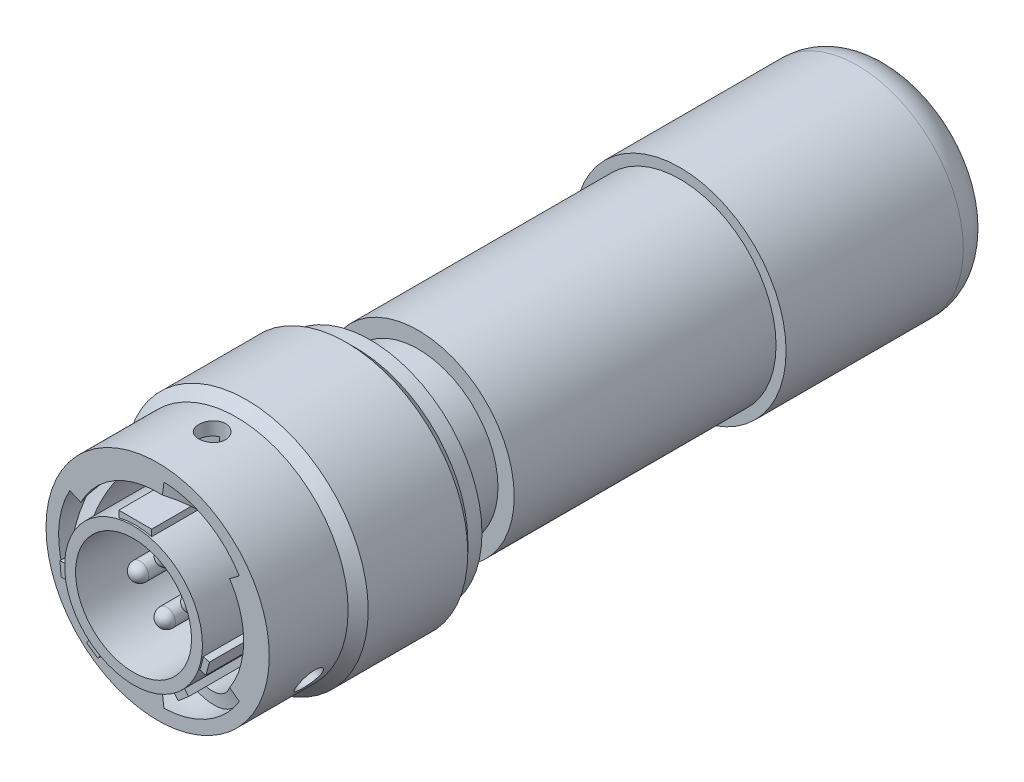
from build123d import *

# Parameters (mm, degrees)
SKETCH3_W               = 22.7718
SKETCH3_H               = 5.1435
BOSS_EXTRUDE1_START     = -9.2202
BOSS_EXTRUDE1_DEPTH     = 9.0678
SKETCH6_R               = 1.1938
CUT_EXTRUDE1_DEPTH      = 36.970404501
CUT_SWEEP1_PITCH        = 19.5072
CIRPATTERN1_COUNT       = 3
SKETCH10_XP_R           = 0.79375
BOSS_EXTRUDE10_XP_DEPTH = 5.7912
FILLET10_XP_R           = 0.79375


with BuildPart() as part:
    # Sketch3 → Revolve1 (revolve)
    with BuildSketch(Plane(origin=(0, 0, 0), x_dir=(0, 0, -1), z_dir=(1, 0, 0)), mode=Mode.PRIVATE) as revolve1_sk:
        Polygon((9.7282, 6.7437), (9.7282, 6.085416667), (19.8, 6.085416667), (20.858333333, 7.14375), (31.441666667, 7.14375), (32.5, 6.085416667), (32.5, 5.1943), (0, 5.1943), (0, 6.1722), (9.2202, 6.1722), (9.2202, 6.7437), align=None)
        with Locations((19.3361, 2.57175)):
            Rectangle(SKETCH3_W, SKETCH3_H)
    revolve(revolve1_sk.sketch.rotate(Axis((0, 0, 0), (0, 0, -1)), 90), axis=Axis((0, 0, 0), (0, 0, -1)))

    # Sketch4 → Boss-Extrude1 (add)
    with BuildSketch(Plane.XY.offset(BOSS_EXTRUDE1_START)):
        with BuildLine():
            Line((-1.4732, 6.580818448), (1.4732, 6.580818448))
            Line((1.4732, 6.580818448), (1.4732, 5.993808022))
            ThreePointArc((1.4732, 5.993808022), (0, 6.1722), (-1.4732, 5.993808022))
            Line((-1.4732, 5.993808022), (-1.4732, 6.580818448))
        make_face()
        with BuildLine():
            Line((6.645021782, -1.149423861), (6.329469602, -2.327080628))
            Line((6.329469602, -2.327080628), (5.774962091, -2.178500788))
            ThreePointArc((5.774962091, -2.178500788), (5.961887385, -1.59748291), (6.090514271, -1.000844021))
            Line((6.090514271, -1.000844021), (6.645021782, -1.149423861))
        make_face()
        with BuildLine():
            Line((4.784000735, -4.752980818), (3.85003935, -5.536667472))
            Line((3.85003935, -5.536667472), (3.481035284, -5.096905551))
            ThreePointArc((3.481035284, -5.096905551), (3.967413685, -4.728179512), (4.414996669, -4.313218897))
            Line((4.414996669, -4.313218897), (4.784000735, -4.752980818))
        make_face()
        with BuildLine():
            Line((-3.352836422, -5.85115182), (-4.351546594, -5.151847428))
            Line((-4.351546594, -5.151847428), (-4.022274477, -4.681598111))
            ThreePointArc((-4.022274477, -4.681598111), (-3.54022848, -5.055970248), (-3.023564305, -5.380902502))
            Line((-3.023564305, -5.380902502), (-3.352836422, -5.85115182))
        make_face()
        with BuildLine():
            Line((-6.637404047, -1.192626182), (-6.743664328, 0.021934394))
            Line((-6.743664328, 0.021934394), (-6.171780414, 0.071967753))
            ThreePointArc((-6.171780414, 0.071967753), (-6.148712916, -0.537942675), (-6.065520133, -1.142592823))
            Line((-6.065520133, -1.142592823), (-6.637404047, -1.192626182))
        make_face()
    extrude(amount=BOSS_EXTRUDE1_DEPTH)

    # Sketch10-xP → Boss-Extrude10-xP (add)
    with BuildSketch(Plane.XY.offset(-7.9502)):
        with Locations(Location((0, 2.3876, 0), (0, 0, 180))):
            Circle(SKETCH10_XP_R)
        with Locations(Location((2.3876, 0, 0), (0, 0, 180))):
            Circle(SKETCH10_XP_R)
        with Locations(Location((0, -2.3876, 0), (0, 0, 180))):
            Circle(SKETCH10_XP_R)
        with Locations(Location((-2.3876, 0, 0), (0, 0, 180))):
            Circle(SKETCH10_XP_R)
    extrude(amount=BOSS_EXTRUDE10_XP_DEPTH)

    # Fillet10-xP
    fillet10_xp_edges = [part.edges().sort_by_distance(p)[0] for p in [
        (3.18135, 0, -2.159),
        (0.79375, -2.3876, -2.159),
        (-1.59385, 0, -2.159),
        (0.79375, 2.3876, -2.159),
    ]]
    fillet(fillet10_xp_edges, radius=FILLET10_XP_R)


with BuildPart() as body_2:
    # Sketch5 → Revolve2 (revolve)
    with BuildSketch(Plane(origin=(0, 0, 0), x_dir=(0, 0, -1), z_dir=(1, 0, 0)), mode=Mode.PRIVATE) as revolve2_sk:
        Polygon((2.159, 10), (2.159, 7.7089), (17.399, 7.7089), (17.399, 8.9789), (21.209, 8.9789), (21.209, 10), (19.939, 10), (19.039, 10.9), (10.1202, 10.9), (9.2202, 10), align=None)
    revolve(revolve2_sk.sketch.rotate(Axis((0, 0, -32.5), (0, 0, 1)), 90), axis=Axis((0, 0, -32.5), (0, 0, 1)))

    # Sketch6 → Cut-Extrude1 (cut, through all)
    with BuildSketch(Plane(origin=(0, 0, 0), x_dir=(1, 0, 0), z_dir=(0, 1, 0))):
        with Locations(Location((0, 7.0358, 0), (0, 0, 90))):
            Circle(SKETCH6_R)
    cut_extrude1 = extrude(amount=CUT_EXTRUDE1_DEPTH, mode=Mode.SUBTRACT)

    # Cut-Sweep1: arcs per turn and ends read off the stored shape
    # Cut-Sweep1: the profile of Sketch8 screwed along a right-hand helix through 1.25 turns, 20 arcs to a turn; built about Z, then put on its axis
    cut_sweep1_z = Axis((0, 0, 0), (0, 0, 1))
    cut_sweep1_corners = [(7.590446941, 0.502912226, -20.755932851), (8.770179735, 0.502912226, -20.755932851), (8.770179735, -0.502912226, -18.258467149), (7.590446941, -0.502912226, -18.258467149)]
    with BuildLine(mode=Mode.PRIVATE) as cut_sweep1_profile:
        Line(cut_sweep1_corners[0], cut_sweep1_corners[1])
        Line(cut_sweep1_corners[2], cut_sweep1_corners[3])
        ThreePointArc((8.770179735, 0.502912226, -20.755932851), (8.87289733, 0, -19.5072), (8.770179735, -0.502912226, -18.258467149))
        ThreePointArc((7.590446941, -0.502912226, -18.258467149), (7.7089, 0, -19.5072), (7.590446941, 0.502912226, -20.755932851))
    cut_sweep1_cap = Face(cut_sweep1_profile.wire())
    cut_sweep1_arcs = [((8.770179735, 0.502912226, -20.755932851), (8.976817967, 0, -19.5072), (8.770179735, -0.502912226, -18.258467149), (1, 0.9884234437826221, 1)), ((7.590446941, -0.502912226, -18.258467149), (7.829201583, 0, -19.5072), (7.590446941, 0.502912226, -20.755932851), (1, 0.9846342463109203, 1))]  # start, shoulder, end, weights
    cut_sweep1_turn_angles = [0, 9, 18, 27, 36, 45, 54, 63, 72, 81, 90, 99, 108, 117, 126, 135, 144, 153, 162, 171, 180, 189, 198, 207, 216, 225, 234, 243, 252, 261, 270, 279, 288, 297, 306, 315, 324, 333, 342, 351, 360]
    cut_sweep1_turn_weights = [1, 0.9876883405951378, 1, 0.9876883405951378, 1, 0.9876883405951378, 1, 0.9876883405951378, 1, 0.9876883405951378, 1, 0.9876883405951378, 1, 0.9876883405951378, 1, 0.9876883405951378, 1, 0.9876883405951378, 1, 0.9876883405951378, 1, 0.9876883405951378, 1, 0.9876883405951378, 1, 0.9876883405951378, 1, 0.9876883405951378, 1, 0.9876883405951378, 1, 0.9876883405951378, 1, 0.9876883405951378, 1, 0.9876883405951378, 1, 0.9876883405951378, 1, 0.9876883405951378, 1]
    cut_sweep1_turn_rails = [Edge.make_bspline([Vector(p[0], p[1], 0).rotate(cut_sweep1_z, cut_sweep1_turn_angles[k]) / cut_sweep1_turn_weights[k] + Vector(0, 0, p[2] + CUT_SWEEP1_PITCH * cut_sweep1_turn_angles[k] / 360) for k in range(41)], [0, 0, 0, 1, 1, 2, 2, 3, 3, 4, 4, 5, 5, 6, 6, 7, 7, 8, 8, 9, 9, 10, 10, 11, 11, 12, 12, 13, 13, 14, 14, 15, 15, 16, 16, 17, 17, 18, 18, 19, 19, 20, 20, 20], 2, cut_sweep1_turn_weights) for p in cut_sweep1_corners]
    cut_sweep1_turn_sides = [*[Face.make_surface_from_curves(cut_sweep1_turn_rails[p[0]], cut_sweep1_turn_rails[p[1]]) for p in [(0, 1), (2, 3)]], *[Face.make_bezier_surface([[Vector(p[j][0], p[j][1], 0).rotate(cut_sweep1_z, cut_sweep1_turn_angles[2 * i + k]) / cut_sweep1_turn_weights[2 * i + k] + Vector(0, 0, p[j][2] + CUT_SWEEP1_PITCH * cut_sweep1_turn_angles[2 * i + k] / 360) for k in range(3)] for j in range(3)], [[p[3][j] * cut_sweep1_turn_weights[2 * i + k] for k in range(3)] for j in range(3)]) for p in cut_sweep1_arcs for i in range(20)]]
    cut_sweep1_last_angles = [360, 369, 378, 387, 396, 405, 414, 423, 432, 441, 450]
    cut_sweep1_last_weights = [1, 0.9876883405951378, 1, 0.9876883405951378, 1, 0.9876883405951378, 1, 0.9876883405951378, 1, 0.9876883405951378, 1]
    cut_sweep1_last_rails = [Edge.make_bspline([Vector(p[0], p[1], 0).rotate(cut_sweep1_z, cut_sweep1_last_angles[k]) / cut_sweep1_last_weights[k] + Vector(0, 0, p[2] + CUT_SWEEP1_PITCH * cut_sweep1_last_angles[k] / 360) for k in range(11)], [0, 0, 0, 1, 1, 2, 2, 3, 3, 4, 4, 5, 5, 5], 2, cut_sweep1_last_weights) for p in cut_sweep1_corners]
    cut_sweep1_last_sides = [*[Face.make_surface_from_curves(cut_sweep1_last_rails[p[0]], cut_sweep1_last_rails[p[1]]) for p in [(0, 1), (2, 3)]], *[Face.make_bezier_surface([[Vector(p[j][0], p[j][1], 0).rotate(cut_sweep1_z, cut_sweep1_last_angles[2 * i + k]) / cut_sweep1_last_weights[2 * i + k] + Vector(0, 0, p[j][2] + CUT_SWEEP1_PITCH * cut_sweep1_last_angles[2 * i + k] / 360) for k in range(3)] for j in range(3)], [[p[3][j] * cut_sweep1_last_weights[2 * i + k] for k in range(3)] for j in range(3)]) for p in cut_sweep1_arcs for i in range(5)]]
    cut_sweep1 = Plane(origin=(0, 0, -2.159), x_dir=(-1, 0, 0), z_dir=(0, 0, -1)) * Solid(Shell([*cut_sweep1_turn_sides, *cut_sweep1_last_sides, cut_sweep1_cap, cut_sweep1_cap.rotate(cut_sweep1_z, 450).moved(Location((0, 0, CUT_SWEEP1_PITCH * 450 / 360)))]))
    add(cut_sweep1, mode=Mode.SUBTRACT)

    # CirPattern1: Cut-Extrude1, Cut-Sweep1 ×3 about axis
    cirpattern1_axis = Axis((0, 0, -32.5), (0, 0, -1))
    add([cut_extrude1.rotate(cirpattern1_axis, i * 360 / CIRPATTERN1_COUNT) for i in range(1, CIRPATTERN1_COUNT)], mode=Mode.SUBTRACT)
    add([cut_sweep1.rotate(cirpattern1_axis, i * 360 / CIRPATTERN1_COUNT) for i in range(1, CIRPATTERN1_COUNT)], mode=Mode.SUBTRACT)


with BuildPart() as body_3:
    # Sketch9 → Revolve3 (revolve)
    with BuildSketch(Plane(origin=(0, 0, 0), x_dir=(0, 0, -1), z_dir=(1, 0, 0)), mode=Mode.PRIVATE) as revolve3_sk:
        with BuildLine():
            Line((25.5, 8.6), (25.5, 7.14375))
            Line((25.5, 7.14375), (64.825, 7.14375))
            ThreePointArc((64.825, 7.14375), (65.403943677, 6.903943677), (65.64375, 6.325))
            Line((65.64375, 6.325), (65.64375, 3.15))
            Line((65.64375, 3.15), (68, 3.15))
            Line((68, 3.15), (68, 6.325))
            ThreePointArc((68, 6.325), (67.07006403, 8.57006403), (64.825, 9.5))
            Line((64.825, 9.5), (48.95, 9.5))
            Line((48.95, 9.5), (48.95, 8.6))
            Line((48.95, 8.6), (25.5, 8.6))
        make_face()
    revolve(revolve3_sk.sketch.rotate(Axis((0, 0, 0), (0, 0, -1)), 90), axis=Axis((0, 0, 0), (0, 0, -1)))


solid = Compound([part.part, body_2.part, body_3.part])
